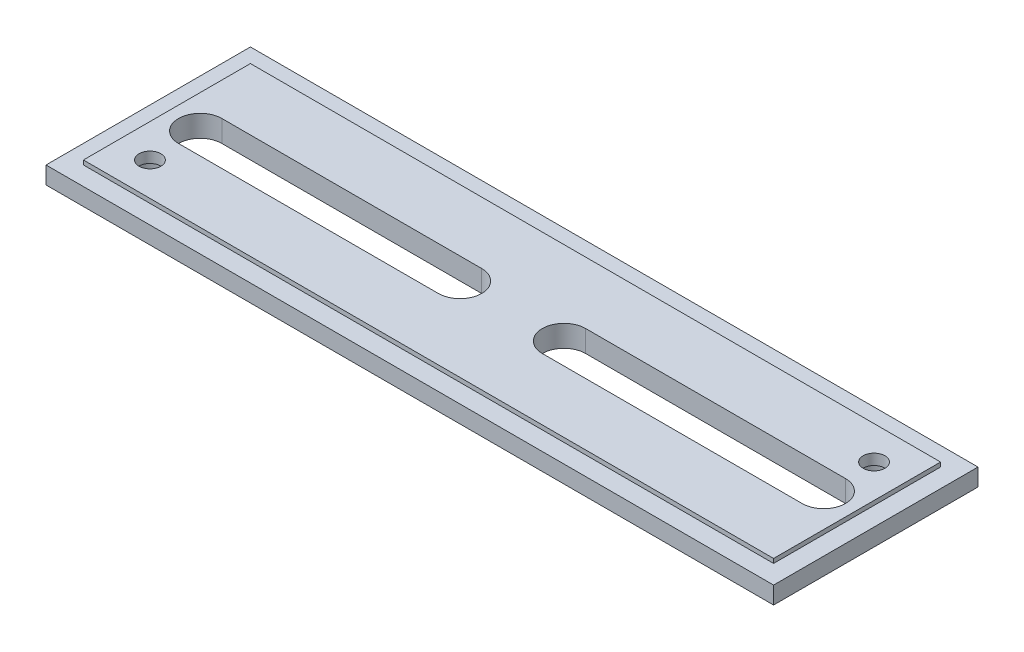
from build123d import *

# Parameters (mm, degrees)
SKETCH1_W           = 133.35
SKETCH1_H           = 37.465
BOSS_EXTRUDE1_DEPTH = 3.175
SKETCH2_W           = 126.492
SKETCH2_H           = 30.607
BOSS_EXTRUDE2_DEPTH = 0.79375
CUT_EXTRUDE1_REACH  = 71.37
CUT_EXTRUDE2_REACH  = 71.37
SKETCH5_R           = 2
SKETCH6_R           = 3.175
CUT_EXTRUDE3_DEPTH  = 2


with BuildPart() as part:
    # Sketch1 → Boss-Extrude1 (new body)
    with BuildSketch(Plane(origin=(0, 0, 0), x_dir=(1, 0, 0), z_dir=(0, 1, 0))):
        Rectangle(SKETCH1_W, SKETCH1_H)
    extrude(amount=BOSS_EXTRUDE1_DEPTH)

    # Sketch2 → Boss-Extrude2 (add)
    with BuildSketch(Plane(origin=(0, 3.175, 0), x_dir=(1, 0, 0), z_dir=(0, 1, 0))):
        Rectangle(SKETCH2_W, SKETCH2_H)
    extrude(amount=BOSS_EXTRUDE2_DEPTH)

    # Sketch3 → Cut-Extrude1 (cut, up to next)
    with BuildSketch(Plane(origin=(0, 0, 0), x_dir=(1, 0, 0), z_dir=(0, 1, 0)), mode=Mode.PRIVATE) as cut_extrude1_sk1:
        with BuildLine():
            Line((-9.525, -3.96875), (-57.15, -3.96875))
            ThreePointArc((-57.15, -3.96875), (-61.11875, 0), (-57.15, 3.96875))
            Line((-57.15, 3.96875), (-9.525, 3.96875))
            ThreePointArc((-9.525, 3.96875), (-5.55625, 0), (-9.525, -3.96875))
        make_face()
    cut_extrude1_tool1 = extrude(cut_extrude1_sk1.sketch, amount=CUT_EXTRUDE1_REACH, mode=Mode.PRIVATE) & part.part
    cut_extrude1 = cut_extrude1_tool1.solids().sort_by_distance((-33.3375, 0, 0))[0]
    add(cut_extrude1, mode=Mode.SUBTRACT)

    # Mirror1: Cut-Extrude1 across plane
    add(cut_extrude1.mirror(Plane(origin=(0, 0, 0), x_dir=(0, 0, 1), z_dir=(1, 0, 0))), mode=Mode.SUBTRACT)

    # Sketch5 → Cut-Extrude2 (cut, up to next)
    with BuildSketch(Plane(origin=(0, 0, 0), x_dir=(1, 0, 0), z_dir=(0, 1, 0)), mode=Mode.PRIVATE) as cut_extrude2_sk1:
        with Locations((-57.15, -9.2075)):
            Circle(SKETCH5_R)
    cut_extrude2_tool1 = extrude(cut_extrude2_sk1.sketch, amount=CUT_EXTRUDE2_REACH, mode=Mode.PRIVATE) & part.part
    # Sketch5 → Cut-Extrude2 (cut, up to next)
    with BuildSketch(Plane(origin=(0, 0, 0), x_dir=(1, 0, 0), z_dir=(0, 1, 0)), mode=Mode.PRIVATE) as cut_extrude2_sk2:
        with Locations((57.15, 9.2075)):
            Circle(SKETCH5_R)
    cut_extrude2_tool2 = extrude(cut_extrude2_sk2.sketch, amount=CUT_EXTRUDE2_REACH, mode=Mode.PRIVATE) & part.part
    add(cut_extrude2_tool1.solids().sort_by_distance((-57.15, 0, 9.2075))[0], mode=Mode.SUBTRACT)
    add(cut_extrude2_tool2.solids().sort_by_distance((57.15, 0, -9.2075))[0], mode=Mode.SUBTRACT)

    # Sketch6 → Cut-Extrude3 (cut)
    with BuildSketch(Plane(origin=(0, 0, 0), x_dir=(-1, 0, 0), z_dir=(0, -1, 0))):
        with Locations((57.15, -9.2075)):
            Circle(SKETCH6_R)
        with Locations((-57.15, 9.2075)):
            Circle(SKETCH6_R)
    extrude(amount=-CUT_EXTRUDE3_DEPTH, mode=Mode.SUBTRACT)


solid = part.part
